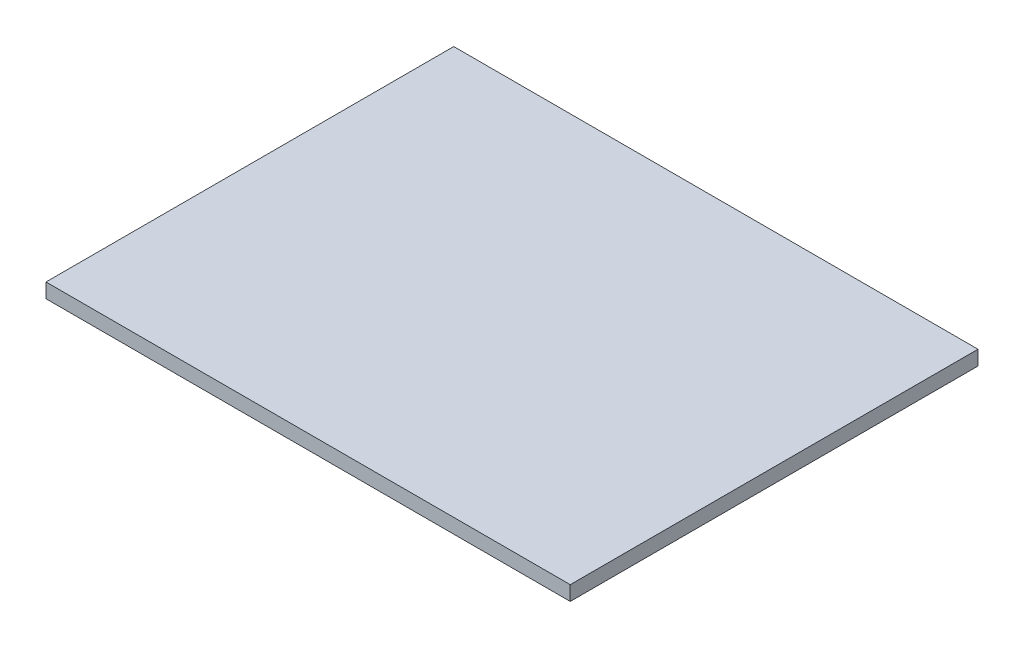
from build123d import *

# Parameters (mm, degrees)
SKETCH1_W  = 180
SKETCH1_H  = 140
BODY_DEPTH = 5


with BuildPart() as part:
    # Sketch1 → Body (new body)
    with BuildSketch(Plane(origin=(0, 0, 0), x_dir=(1, 0, 0), z_dir=(0, 1, 0))):
        Rectangle(SKETCH1_W, SKETCH1_H)
    extrude(amount=BODY_DEPTH)


solid = part.part
